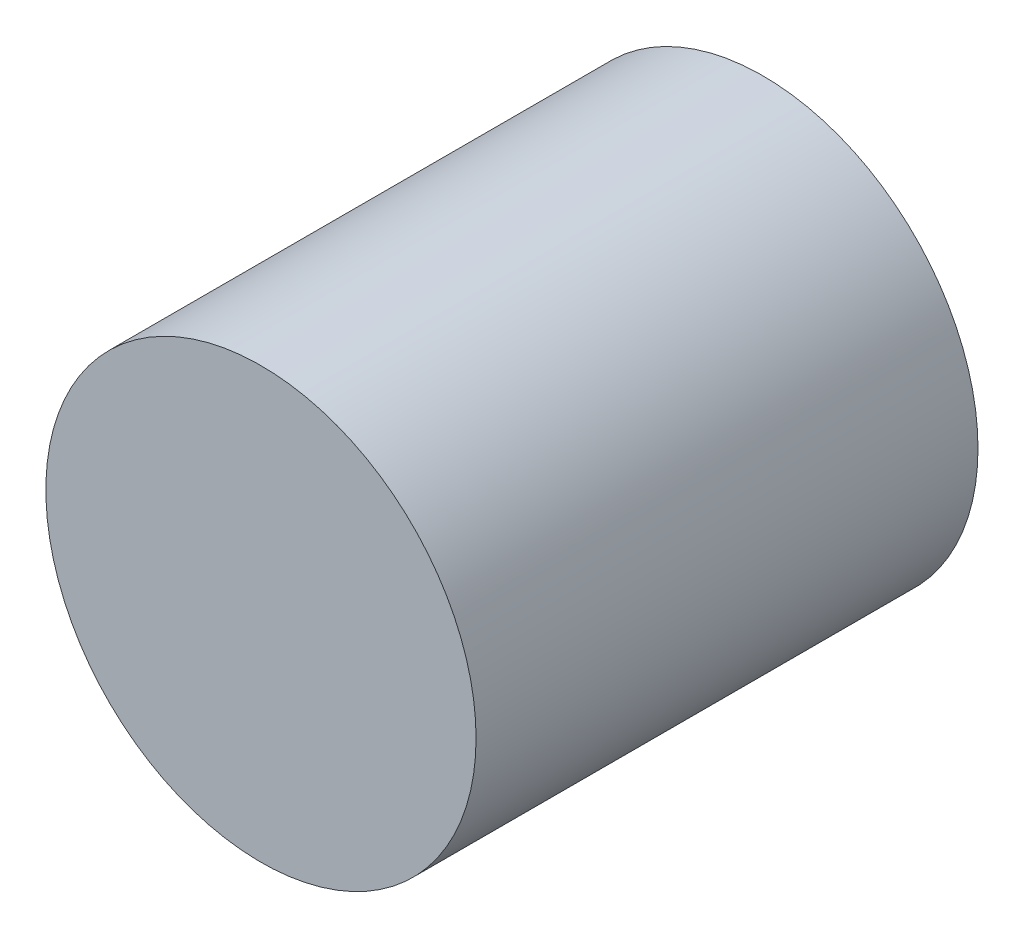
from build123d import *

# Parameters (mm, degrees)
SKETCH_1_R      = 30
EXTRUDE_1_DEPTH = 70


with BuildPart() as part:
    # Эскиз1 → Бобышка-Вытянуть1 (new body)
    with BuildSketch(Plane.XY):
        Circle(SKETCH_1_R)
    extrude(amount=EXTRUDE_1_DEPTH)


solid = part.part
